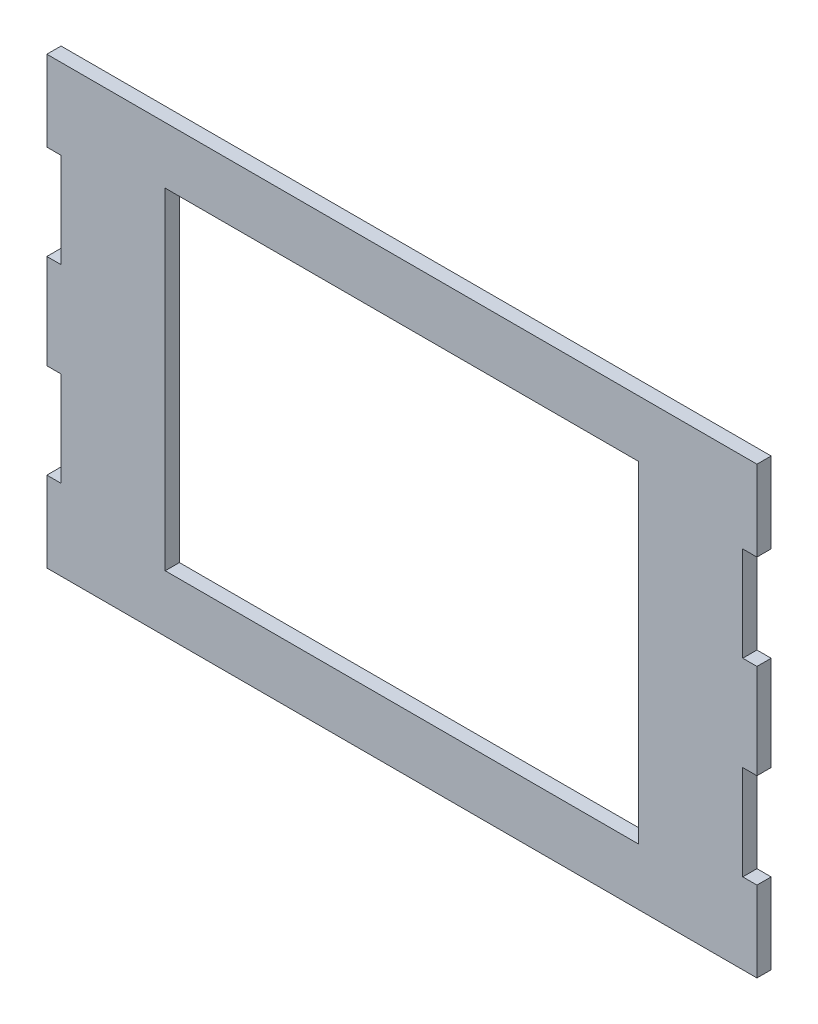
from build123d import *

# Parameters (mm, degrees)
SKETCH1_W           = 150
SKETCH1_H           = 100
BOSS_EXTRUDE1_DEPTH = 3
CAVITY1_START       = -75
CAVITY1_OUTLINE_W   = 3
CAVITY1_OUTLINE_H   = 3
CAVITY1_DEPTH       = 150
CAVITY1_2_OUTLINE_W = 20
CAVITY1_2_OUTLINE_H = 3
CAVITY1_2_DEPTH     = 3
CAVITY1_START_2     = 72
CAVITY1_3_OUTLINE_W = 20
CAVITY1_3_OUTLINE_H = 3
CAVITY1_3_DEPTH     = 3
SKETCH2_W           = 100
SKETCH2_H           = 70
CUT_EXTRUDE1_DEPTH  = 3


# Read off the part's stored shape, not the designer's step: Cavity1
with BuildPart() as part:
    # Sketch1 → Boss-Extrude1 (new body)
    with BuildSketch(Plane.XY):
        Rectangle(SKETCH1_W, SKETCH1_H)
    extrude(amount=BOSS_EXTRUDE1_DEPTH)

    # Cavity1 outline → Cavity1 (cut)
    with BuildSketch(Plane.YZ.offset(CAVITY1_START)):
        with Locations((48.5, 1.5)):
            Rectangle(CAVITY1_OUTLINE_W, CAVITY1_OUTLINE_H)
        with Locations((-48.5, 1.5)):
            Rectangle(CAVITY1_OUTLINE_W, CAVITY1_OUTLINE_H)
    extrude(amount=CAVITY1_DEPTH, mode=Mode.SUBTRACT)

    # Cavity1 2 outline → Cavity1 2 (cut)
    with BuildSketch(Plane.YZ.offset(CAVITY1_START)):
        with Locations((20, 1.5)):
            Rectangle(CAVITY1_2_OUTLINE_W, CAVITY1_2_OUTLINE_H)
        with Locations((-20, 1.5)):
            Rectangle(CAVITY1_2_OUTLINE_W, CAVITY1_2_OUTLINE_H)
    extrude(amount=CAVITY1_2_DEPTH, mode=Mode.SUBTRACT)

    # Cavity1 3 outline → Cavity1 3 (cut)
    with BuildSketch(Plane.YZ.offset(CAVITY1_START_2)):
        with Locations((20, 1.5)):
            Rectangle(CAVITY1_3_OUTLINE_W, CAVITY1_3_OUTLINE_H)
        with Locations((-20, 1.5)):
            Rectangle(CAVITY1_3_OUTLINE_W, CAVITY1_3_OUTLINE_H)
    extrude(amount=CAVITY1_3_DEPTH, mode=Mode.SUBTRACT)

    # Sketch2 → Cut-Extrude1 (cut)
    with BuildSketch(Plane.XY.offset(3)):
        Rectangle(SKETCH2_W, SKETCH2_H)
    extrude(amount=-CUT_EXTRUDE1_DEPTH, mode=Mode.SUBTRACT)


solid = part.part
